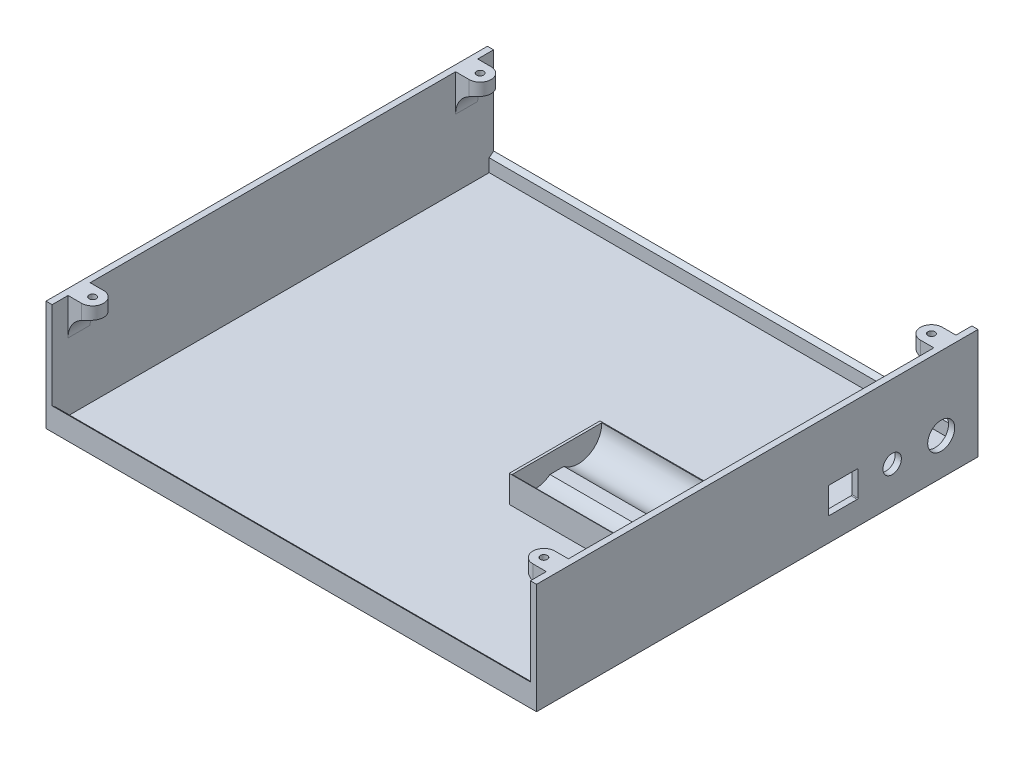
from build123d import *
from build123d.topology import SkipClean

# Parameters (mm, degrees)
SALIENTE_EXTRUIR1_DEPTH    = 200
CROQUIS2_W                 = 2.5
CROQUIS2_H                 = 180
SALIENTE_EXTRUIR2_DEPTH    = 42.5
CROQUIS3_R                 = 5.5
CORTAR_EXTRUIR1_DEPTH      = 4
CROQUIS4_R                 = 3.75
CORTAR_EXTRUIR2_DEPTH      = 4
CROQUIS7_W                 = 12.1
CROQUIS7_H                 = 10.75
CORTAR_EXTRUIR3_DEPTH      = 4
REDONDEO1_R                = 0.3
CROQUIS8_R                 = 1.425
SALIENTE_EXTRUIR3_DEPTH    = 5
SIMETR_A2_COPY_1_SKETCH_R  = 1.425
SIMETR_A2_COPY_1_DEPTH     = 5
REDONDEO4_START            = 29.9999999
REDONDEO4_OUTLINE_R        = 1.425
REDONDEO4_DEPTH            = 10.0000001
REDONDEO4_2_OUTLINE_W      = 10
REDONDEO4_2_OUTLINE_H      = 9.000004552
REDONDEO4_2_OUTLINE_H_2    = 9.000004551
REDONDEO5_START            = 29.9999999
REDONDEO5_OUTLINE_R        = 1.425
REDONDEO5_DEPTH            = 10.0000001
REDONDEO5_2_OUTLINE_W      = 10
REDONDEO5_2_OUTLINE_H      = 9.000004551
REDONDEO5_2_OUTLINE_H_2    = 9.000004552
CROQUIS9_W                 = 67
CROQUIS9_H                 = 37
SALIENTE_EXTRUIR4_DEPTH    = 20
CORTAR_EXTRUIR5_DEPTH      = 1
CORTAR_EXTRUIR5_DEPTH_BACK = 66
CROQUIS11_W                = 69.586098965
CROQUIS11_H                = 38.970086607
CORTAR_EXTRUIR6_DEPTH      = 9
CROQUIS12_W                = 37
CROQUIS12_H                = 10.997736301
SALIENTE_EXTRUIR5_DEPTH    = 0.7
CROQUIS14_W                = 66
CROQUIS14_H                = 7.054690465
CORTAR_EXTRUIR7_DEPTH      = 7.7


with BuildPart() as part:
    # Croquis1 → Saliente-Extruir1 (new body)
    with BuildSketch(Plane(origin=(0, 0, 0), x_dir=(0, 0, -1), z_dir=(1, 0, 0))):
        Polygon((90, 9.273962115), (90, 0), (-90, 0), (-90, 9.273962115), (-88.2, 7.766551311), (-88.2, 2.5), (88.2, 2.5), (88.2, 7.766551311), align=None)
    extrude(amount=SALIENTE_EXTRUIR1_DEPTH)

    # Croquis2 → Saliente-Extruir2 (add)
    with BuildSketch(Plane(origin=(0, 2.5, 0), x_dir=(1, 0, 0), z_dir=(0, 1, 0))):
        with Locations((198.75, 0)):
            Rectangle(CROQUIS2_W, CROQUIS2_H)
        with Locations((1.25, 0)):
            Rectangle(CROQUIS2_W, CROQUIS2_H)
    extrude(amount=SALIENTE_EXTRUIR2_DEPTH)

    # Croquis3 → Cortar-Extruir1 (cut)
    with BuildSketch(Plane(origin=(200, 0, 0), x_dir=(0, 0, -1), z_dir=(1, 0, 0))):
        with Locations((75, 15)):
            Circle(CROQUIS3_R)
    extrude(amount=-CORTAR_EXTRUIR1_DEPTH, mode=Mode.SUBTRACT)

    # Croquis4 → Cortar-Extruir2 (cut)
    with BuildSketch(Plane(origin=(200, 0, 0), x_dir=(0, 0, -1), z_dir=(1, 0, 0))):
        with Locations((55, 15)):
            Circle(CROQUIS4_R)
    extrude(amount=-CORTAR_EXTRUIR2_DEPTH, mode=Mode.SUBTRACT)

    # Croquis7 → Cortar-Extruir3 (cut)
    with BuildSketch(Plane(origin=(200, 0, 0), x_dir=(0, 0, -1), z_dir=(1, 0, 0))):
        with Locations((35, 15)):
            Rectangle(CROQUIS7_W, CROQUIS7_H)
    extrude(amount=-CORTAR_EXTRUIR3_DEPTH, mode=Mode.SUBTRACT)

    # Redondeo1
    redondeo1_edges = [part.edges().sort_by_distance(p)[0] for p in [
        (198.75, 20.375, -41.05),
        (198.75, 9.625, -41.05),
        (198.75, 9.625, -28.95),
        (198.75, 20.375, -28.95),
    ]]
    fillet(redondeo1_edges, radius=REDONDEO1_R)

    # Croquis8 → Saliente-Extruir3 (add)
    with BuildSketch(Plane(origin=(0, 45, 0), x_dir=(1, 0, 0), z_dir=(0, 1, 0))):
        with BuildLine():
            Line((192, -74.506703602), (197.5, -74.506703602))
            Line((197.5, -74.506703602), (197.5, -83.506703602))
            Line((197.5, -83.506703602), (192, -83.506703602))
            ThreePointArc((192, -83.506703602), (187.5, -79.006703602), (192, -74.506703602))
        make_face()
        with Locations(Location((192, -79.006703602, 0), (0, 0, 270))):
            Circle(CROQUIS8_R, mode=Mode.SUBTRACT)
    saliente_extruir3 = extrude(amount=-SALIENTE_EXTRUIR3_DEPTH)

    # Simetría1: Saliente-Extruir3 across plane
    add(saliente_extruir3.mirror(Plane.XY))

    # Simetría2: Saliente-Extruir3 across plane
    add(saliente_extruir3.mirror(Plane(origin=(100, 0, 0), x_dir=(0, 0, 1), z_dir=(1, 0, 0))))

    # Simetría2 copy 1 sketch → Simetría2 copy 1 (add)
    with BuildSketch(Plane(origin=(200, 45, 0), x_dir=(-1, 0, 0), z_dir=(0, 1, 0))):
        with BuildLine():
            Line((192, -74.506703602), (197.5, -74.506703602))
            Line((197.5, -74.506703602), (197.5, -83.506703602))
            Line((197.5, -83.506703602), (192, -83.506703602))
            ThreePointArc((192, -83.506703602), (187.5, -79.006703602), (192, -74.506703602))
        make_face()
        with Locations(Location((192, -79.006703602, 0), (0, 0, 270))):
            Circle(SIMETR_A2_COPY_1_SKETCH_R, mode=Mode.SUBTRACT)
    extrude(amount=-SIMETR_A2_COPY_1_DEPTH)

    # Redondeo4: read off the stored shape, not the designer's step
    # Redondeo4 outline → Redondeo4 (add)
    # profile 1 of 2: a face of its own
    with SkipClean():  # the faces are left unmerged after this step: merging them gives an invalid solid
        with BuildSketch(Plane(origin=(0, 0, 0), x_dir=(1, 0, 0), z_dir=(0, 1, 0)).offset(REDONDEO4_START)):
            with BuildLine():
                Line((197.5, -74.506703602), (192, -74.506703602))
                ThreePointArc((192, -74.506703602), (187.5, -79.006703602), (192, -83.506703602))
                Line((192, -83.506703602), (197.5, -83.506703602))
                Line((197.5, -83.506703602), (197.5, -74.506703602))
            make_face()
            with Locations((192, -79.006703602)):
                Circle(REDONDEO4_OUTLINE_R, mode=Mode.SUBTRACT)
        # profile 2 of 2: a face of its own
        with BuildSketch(Plane(origin=(0, 0, 0), x_dir=(1, 0, 0), z_dir=(0, 1, 0)).offset(REDONDEO4_START)):
            with BuildLine():
                Line((192, 74.506703602), (197.5, 74.506703602))
                Line((197.5, 74.506703602), (197.5, 83.506703602))
                Line((197.5, 83.506703602), (192, 83.506703602))
                ThreePointArc((192, 83.506703602), (187.5, 79.006703602), (192, 74.506703602))
            make_face()
            with Locations((192, 79.006703602)):
                Circle(REDONDEO4_OUTLINE_R, mode=Mode.SUBTRACT)
        extrude(amount=REDONDEO4_DEPTH)
    add(part.part.scale(1), mode=Mode.REPLACE)  # the faces are merged on a copy

    # Redondeo4 2 outline → Redondeo4 2 (revolve, cut)
    with BuildSketch(Plane(origin=(187.5, 30, 0), x_dir=(1, 0, 0), z_dir=(0, -1, 0))):
        with Locations((5, -79.006704338)):
            Rectangle(REDONDEO4_2_OUTLINE_W, REDONDEO4_2_OUTLINE_H)
        with Locations((5, 79.006702866)):
            Rectangle(REDONDEO4_2_OUTLINE_W, REDONDEO4_2_OUTLINE_H_2)
    revolve(axis=Axis((187.5, 30, 0), (0, 0, 1)), mode=Mode.SUBTRACT)

    # Redondeo5: read off the stored shape, not the designer's step
    # Redondeo5 outline → Redondeo5 (add)
    # profile 1 of 2: a face of its own
    with BuildSketch(Plane(origin=(0, 0, 0), x_dir=(1, 0, 0), z_dir=(0, 1, 0)).offset(REDONDEO5_START)):
        with BuildLine():
            Line((2.5, 83.506703602), (2.5, 74.506703602))
            Line((2.5, 74.506703602), (8, 74.506703602))
            ThreePointArc((8, 74.506703602), (12.5, 79.006703602), (8, 83.506703602))
            Line((8, 83.506703602), (2.5, 83.506703602))
        make_face()
        with Locations((8, 79.006703602)):
            Circle(REDONDEO5_OUTLINE_R, mode=Mode.SUBTRACT)
    # profile 2 of 2: a face of its own
    with BuildSketch(Plane(origin=(0, 0, 0), x_dir=(1, 0, 0), z_dir=(0, 1, 0)).offset(REDONDEO5_START)):
        with BuildLine():
            Line((8, -74.506703602), (2.5, -74.506703602))
            Line((2.5, -74.506703602), (2.5, -83.506703602))
            Line((2.5, -83.506703602), (8, -83.506703602))
            ThreePointArc((8, -83.506703602), (12.5, -79.006703602), (8, -74.506703602))
        make_face()
        with Locations((8, -79.006703602)):
            Circle(REDONDEO5_OUTLINE_R, mode=Mode.SUBTRACT)
    extrude(amount=REDONDEO5_DEPTH)

    # Redondeo5 2 outline → Redondeo5 2 (revolve, cut)
    with BuildSketch(Plane(origin=(12.5, 30, 0), x_dir=(1, 0, 0), z_dir=(0, -1, 0))):
        with Locations((5, -79.006702866)):
            Rectangle(REDONDEO5_2_OUTLINE_W, REDONDEO5_2_OUTLINE_H)
        with Locations((5, 79.006704338)):
            Rectangle(REDONDEO5_2_OUTLINE_W, REDONDEO5_2_OUTLINE_H_2)
    revolve(axis=Axis((12.5, 30, 0), (0, 0, 1)), mode=Mode.SUBTRACT)

    # Croquis9 → Saliente-Extruir4 (add)
    with BuildSketch(Plane(origin=(0, 2.5, 0), x_dir=(1, 0, 0), z_dir=(0, 1, 0))):
        with Locations((157.239750521, -6.353396278)):
            Rectangle(CROQUIS9_W, CROQUIS9_H)
    extrude(amount=SALIENTE_EXTRUIR4_DEPTH)

    # Croquis10 → Cortar-Extruir5 (cut, two sides: drawn at the far end of the back side and taken through both)
    with BuildSketch(Plane(origin=(190.739750521, 0, 0), x_dir=(0, 0, -1), z_dir=(1, 0, 0)).offset(-CORTAR_EXTRUIR5_DEPTH_BACK)):
        with BuildLine():
            ThreePointArc((-6.420068532, 16.930863921), (-24.676853259, 13.247289401), (-6.420068532, 9.563714882))
            ThreePointArc((-6.420068532, 9.563714882), (11.836716195, 13.247289401), (-6.420068532, 16.930863921))
        make_face()
    extrude(amount=CORTAR_EXTRUIR5_DEPTH + CORTAR_EXTRUIR5_DEPTH_BACK, mode=Mode.SUBTRACT)

    # Croquis11 → Cortar-Extruir6 (cut)
    with BuildSketch(Plane(origin=(0, 22.5, 0), x_dir=(1, 0, 0), z_dir=(0, 1, 0))):
        with Locations((157.239750521, -6.353396279)):
            Rectangle(CROQUIS11_W, CROQUIS11_H)
    extrude(amount=-CORTAR_EXTRUIR6_DEPTH, mode=Mode.SUBTRACT)

    # Croquis12 → Saliente-Extruir5 (add)
    with BuildSketch(Plane(origin=(190.739750521, 0, 0), x_dir=(0, 0, -1), z_dir=(1, 0, 0))):
        with Locations((-6.353396278, 7.998868151)):
            Rectangle(CROQUIS12_W, CROQUIS12_H)
    extrude(amount=SALIENTE_EXTRUIR5_DEPTH)

    # Croquis14 → Cortar-Extruir7 (cut)
    with BuildSketch(Plane(origin=(0, 13.497736301, 0), x_dir=(1, 0, 0), z_dir=(0, 1, 0))):
        with Locations((157.739750521, -6.420068533)):
            Rectangle(CROQUIS14_W, CROQUIS14_H)
    extrude(amount=-CORTAR_EXTRUIR7_DEPTH, mode=Mode.SUBTRACT)


solid = part.part
